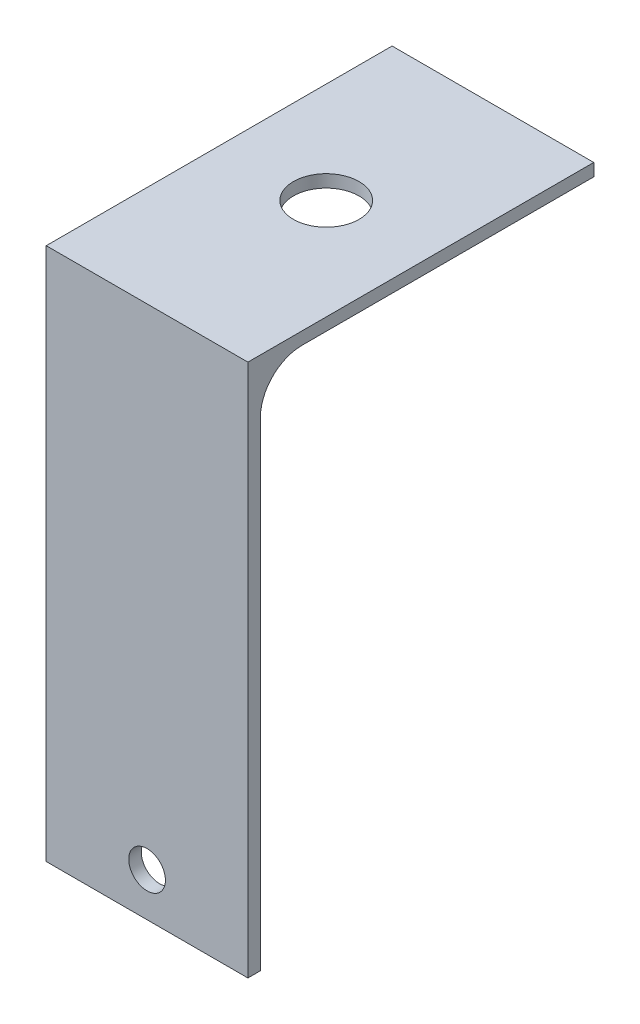
from build123d import *

# Parameters (mm, degrees)
SKETCH1_W           = 24.2
SKETCH1_H           = 64
BOSS_EXTRUDE1_DEPTH = 1.5
SKETCH2_R           = 2.2
CUT_EXTRUDE1_DEPTH  = 35.244123583
SKETCH4_W           = 24.2
SKETCH4_H           = 40
BOSS_EXTRUDE2_DEPTH = 1.5
SKETCH5_R           = 3.937
CUT_EXTRUDE2_DEPTH  = 76.184173867
FILLET1_R           = 5


with BuildPart() as part:
    # Sketch1 → Boss-Extrude1 (new body)
    with BuildSketch(Plane.XY):
        Rectangle(SKETCH1_W, SKETCH1_H)
    extrude(amount=BOSS_EXTRUDE1_DEPTH)

    # Sketch2 → Cut-Extrude1 (cut, through all)
    with BuildSketch(Plane.XY.offset(1.5)):
        with Locations((0, -26.8)):
            Circle(SKETCH2_R)
    extrude(amount=-CUT_EXTRUDE1_DEPTH, mode=Mode.SUBTRACT)

    # Sketch4 → Boss-Extrude2 (add)
    with BuildSketch(Plane(origin=(0, 32, 0), x_dir=(1, 0, 0), z_dir=(0, 1, 0))):
        with Locations((0, 20)):
            Rectangle(SKETCH4_W, SKETCH4_H)
    extrude(amount=-BOSS_EXTRUDE2_DEPTH)

    # Sketch5 → Cut-Extrude2 (cut, through all)
    with BuildSketch(Plane.XZ.offset(-30.5)):
        with Locations((0, -20)):
            Circle(SKETCH5_R)
    extrude(amount=-CUT_EXTRUDE2_DEPTH, mode=Mode.SUBTRACT)

    # Fillet1
    fillet1_edges = [part.edges().sort_by_distance(p)[0] for p in [
        (0, 30.5, 0),
    ]]
    fillet(fillet1_edges, radius=FILLET1_R)


solid = part.part
